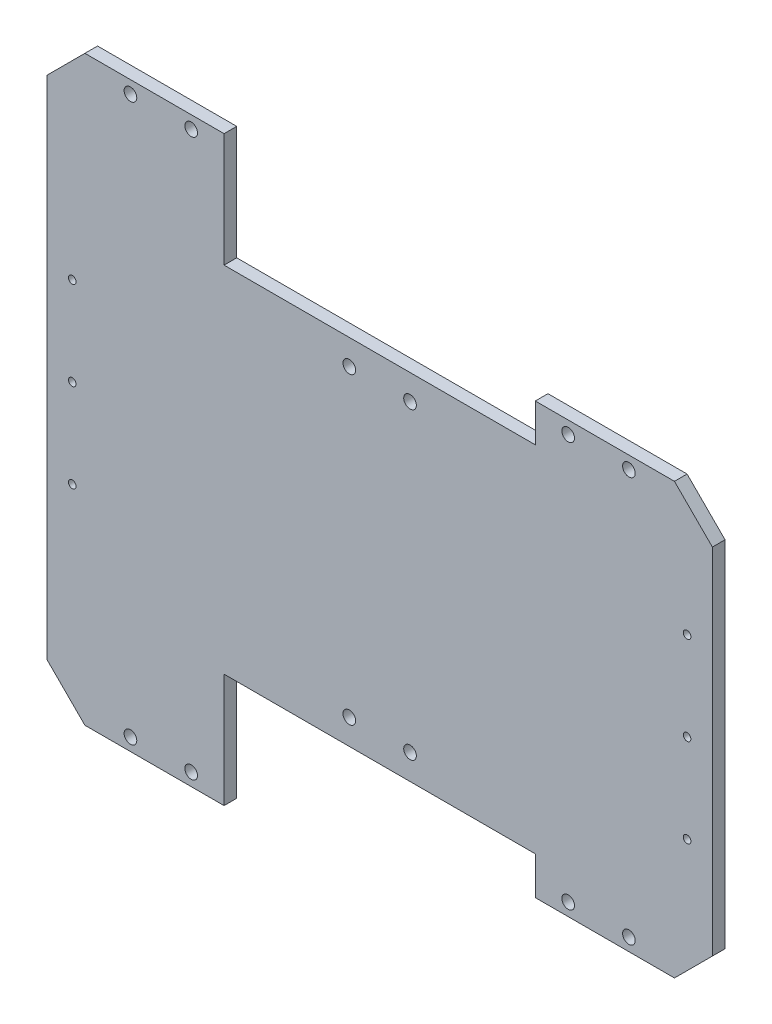
from build123d import *

# Parameters (mm, degrees)
SKETCH_1_R      = 2.5
SKETCH_1_R_2    = 1.5
EXTRUDE_1_DEPTH = 5


with BuildPart() as part:
    # 草图1 → 凸台-拉伸1 (new body)
    with BuildSketch(Plane.XY.offset(5)):
        Polygon((50.930030436, -99.999999909), (50.930030436, 39.999999938), (35.930030436, 54.999999938), (-19.069969566, 54.999999938), (-19.069969566, 39.999999989), (-142.069969574, 39.999999989), (-142.069969574, 84.999999989), (-197.069969604, 84.999999989), (-212.069969578, 70.000000014), (-212.069969578, -129.999999986), (-197.069969604, -144.99999996), (-142.069969574, -144.99999996), (-142.069969574, -99.99999996), (-19.069969566, -99.99999996), (-19.069969566, -114.999999909), (35.930030436, -114.999999909), align=None)
        with Locations((-179.069969574, 79.999999989)):
            Circle(SKETCH_1_R, mode=Mode.SUBTRACT)
        with Locations((-6.069969566, 49.999999938)):
            Circle(SKETCH_1_R, mode=Mode.SUBTRACT)
        with Locations((-155.069969574, 79.999999989)):
            Circle(SKETCH_1_R, mode=Mode.SUBTRACT)
        with Locations((-92.569969578, 30.000000012)):
            Circle(SKETCH_1_R, mode=Mode.SUBTRACT)
        with Locations((-68.569969578, 30)):
            Circle(SKETCH_1_R, mode=Mode.SUBTRACT)
        with Locations((17.930030434, 49.999999938)):
            Circle(SKETCH_1_R, mode=Mode.SUBTRACT)
        with Locations((-202.069969578, 5.000000014)):
            Circle(SKETCH_1_R_2, mode=Mode.SUBTRACT)
        with Locations((-202.069969578, -29.999999986)):
            Circle(SKETCH_1_R_2, mode=Mode.SUBTRACT)
        with Locations((40.930030438, -29.999999986)):
            Circle(SKETCH_1_R_2, mode=Mode.SUBTRACT)
        with Locations((40.930030438, 5.000000014)):
            Circle(SKETCH_1_R_2, mode=Mode.SUBTRACT)
        with Locations((40.930030438, -64.999999986)):
            Circle(SKETCH_1_R_2, mode=Mode.SUBTRACT)
        with Locations((-202.069969578, -64.999999986)):
            Circle(SKETCH_1_R_2, mode=Mode.SUBTRACT)
        with Locations((17.930030434, -109.999999909)):
            Circle(SKETCH_1_R, mode=Mode.SUBTRACT)
        with Locations((-68.569969578, -89.999999972)):
            Circle(SKETCH_1_R, mode=Mode.SUBTRACT)
        with Locations((-92.569969578, -89.999999983)):
            Circle(SKETCH_1_R, mode=Mode.SUBTRACT)
        with Locations((-155.069969574, -139.99999996)):
            Circle(SKETCH_1_R, mode=Mode.SUBTRACT)
        with Locations((-6.069969566, -109.999999909)):
            Circle(SKETCH_1_R, mode=Mode.SUBTRACT)
        with Locations((-179.069969574, -139.99999996)):
            Circle(SKETCH_1_R, mode=Mode.SUBTRACT)
    extrude(amount=EXTRUDE_1_DEPTH)


solid = part.part
